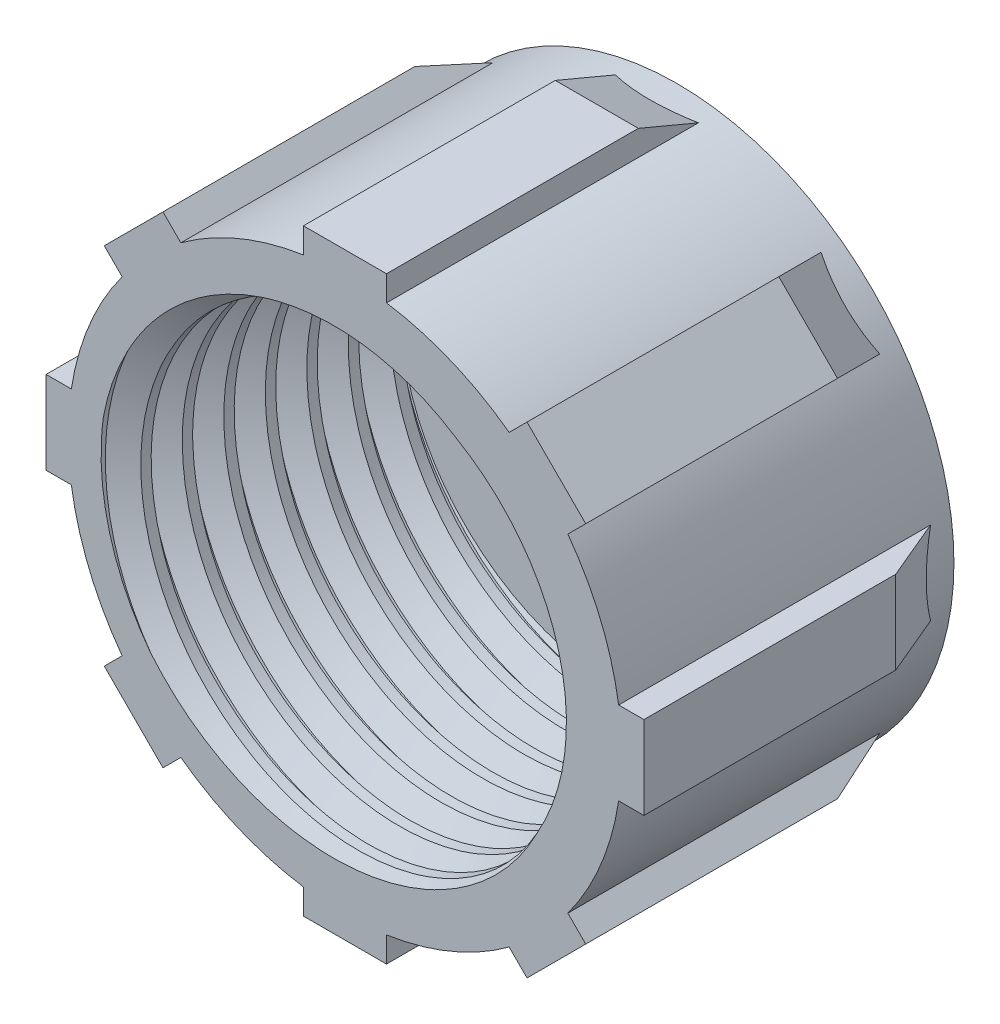
from build123d import *

# Parameters (mm, degrees)
SKETCH1_R           = 10
BOSS_EXTRUDE1_DEPTH = 12
SKETCH2_R           = 8
CUT_EXTRUDE1_DEPTH  = 10
SKETCH3_R           = 5.5
CUT_EXTRUDE2_DEPTH  = 10
THREAD1_PITCH       = 1.5
BOSS_EXTRUDE2_DEPTH = 1.5
CIRPATTERN1_COUNT   = 8


with BuildPart() as part:
    # Sketch1 → Boss-Extrude1 (new body)
    with BuildSketch(Plane.XY):
        Circle(SKETCH1_R)
    extrude(amount=BOSS_EXTRUDE1_DEPTH)

    # Sketch2 → Cut-Extrude1 (cut)
    with BuildSketch(Plane.XY.offset(12)):
        Circle(SKETCH2_R)
    extrude(amount=-CUT_EXTRUDE1_DEPTH, mode=Mode.SUBTRACT)

    # Sketch3 → Cut-Extrude2 (cut)
    with BuildSketch(Plane.XY.offset(2)):
        Circle(SKETCH3_R)
    extrude(amount=-CUT_EXTRUDE2_DEPTH, mode=Mode.SUBTRACT)

    # Thread1: the profile of Thread Profile1 profile screwed along a right-hand helix of 10 turns, 8 arcs to a turn; built about Z, then put on its axis
    thread1_z = Axis((0, 0, 0), (0, 0, 1))
    thread1_corners = [(7.9997, 0, -0.000173205), (8.811898813, 0, 0.468749998), (8.811898813, 0, 0.656249998), (7.9997, 0, 1.125173201)]
    with BuildLine(mode=Mode.PRIVATE) as thread1_profile:
        Line(thread1_corners[0], thread1_corners[1])
        Line(thread1_corners[1], thread1_corners[2])
        Line(thread1_corners[2], thread1_corners[3])
        Line(thread1_corners[3], thread1_corners[0])
    thread1_cap = Face(thread1_profile.wire())
    thread1_turn_angles = [0, 22.5, 45, 67.5, 90, 112.5, 135, 157.5, 180, 202.5, 225, 247.5, 270, 292.5, 315, 337.5, 360]
    thread1_turn_weights = [1, 0.9238795325112867, 1, 0.9238795325112867, 1, 0.9238795325112867, 1, 0.9238795325112867, 1, 0.9238795325112867, 1, 0.9238795325112867, 1, 0.9238795325112867, 1, 0.9238795325112867, 1]
    thread1_turn_rails = [Edge.make_bspline([Vector(p[0], p[1], 0).rotate(thread1_z, thread1_turn_angles[k]) / thread1_turn_weights[k] + Vector(0, 0, p[2] + THREAD1_PITCH * thread1_turn_angles[k] / 360) for k in range(17)], [0, 0, 0, 1, 1, 2, 2, 3, 3, 4, 4, 5, 5, 6, 6, 7, 7, 8, 8, 8], 2, thread1_turn_weights) for p in thread1_corners]
    thread1_turn_sides = [Face.make_surface_from_curves(thread1_turn_rails[p[0]], thread1_turn_rails[p[1]]) for p in [(0, 1), (1, 2), (2, 3), (3, 0)]]
    thread1 = Plane(origin=(0, 0, 17), x_dir=(-1, 0, 0), z_dir=(0, 0, -1)) * Solid(Shell([*[p.moved(Location((0, 0, THREAD1_PITCH * i))) for i in range(10) for p in thread1_turn_sides], thread1_cap, thread1_cap.rotate(thread1_z, 3600).moved(Location((0, 0, THREAD1_PITCH * 3600 / 360)))]))
    add(thread1, mode=Mode.SUBTRACT)

    # Sketch6 → Boss-Extrude2 (add, symmetric)
    with BuildSketch(Plane(origin=(0, 0, 0), x_dir=(0, 0, -1), z_dir=(1, 0, 0))):
        Polygon((-2.902640689, 10.8), (-12, 10.8), (-12, 10), (-1, 10), align=None)
        Polygon((-12, 9.637875341), (-12, 10), (-1, 10), (-0.138758611, 9.637875341), align=None)
    boss_extrude2 = extrude(amount=BOSS_EXTRUDE2_DEPTH, both=True)

    # CirPattern1: Boss-Extrude2 ×8 about axis
    cirpattern1_axis = Axis((0, 0, 0), (0, 0, 1))
    for i in range(1, CIRPATTERN1_COUNT):
        add(boss_extrude2.rotate(cirpattern1_axis, i * 360 / CIRPATTERN1_COUNT))


solid = part.part
